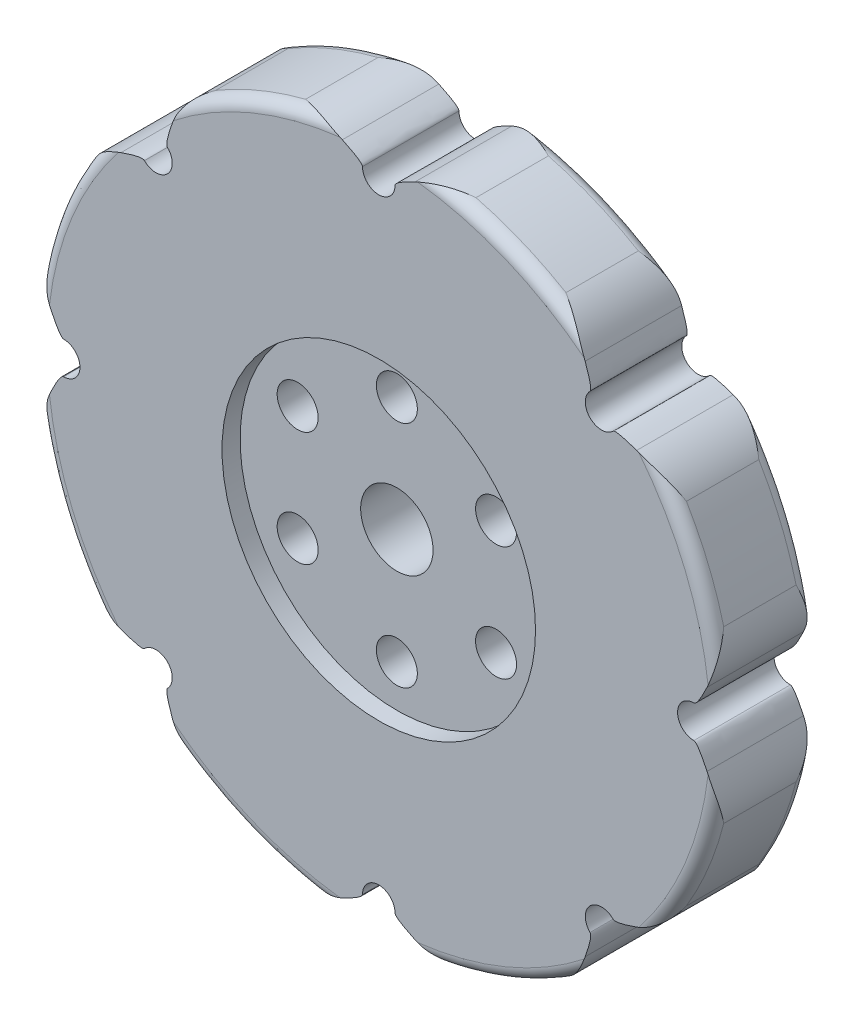
from build123d import *

# Parameters (mm, degrees)
ESQUISSE1_R                        = 28.5
BOSS_EXTRU_1_DEPTH                 = 4
ENL_V_MAT_EXTRU_1_DEPTH            = 41.503086302
CONG_1_R                           = 6
R_P_TITION_CIRCULAIRE1_COUNT       = 8
CONG_1_OF_R_P_TITION_CIRCULAIRE1_R = 6
DIAM_TRE_DU_PER_AGE_6_0_6_1_D      = 6
D_GAGEMENT_M31_D                   = 3.4
ESQUISSE9_R                        = 13
ENL_V_MAT_EXTRU_2_DEPTH            = 1.5


with BuildPart() as part:
    # Esquisse1 → Boss.-Extru.1 (new, symmetric)
    with BuildSketch(Plane.XY):
        Circle(ESQUISSE1_R)
    extrude(amount=BOSS_EXTRU_1_DEPTH, both=True)

    # Esquisse2 → Enlèv. mat.-Extru.1 (cut, symmetric)
    with BuildSketch(Plane.XY):
        with BuildLine():
            ThreePointArc((-1.35, 26.131259298), (0, 24.781259298), (1.35, 26.131259298))
            add(Edge.make_bspline(
                [(1.35, 26.131259298), (1.35, 26.580785033), (4.948973064, 28.067020961)],
                knots=[0, 0, 0, 1, 1, 1], degree=2))
            ThreePointArc((4.948973064, 28.067020961), (0, 28.5), (-4.948973064, 28.067020961))
            add(Edge.make_bspline(
                [(-1.35, 26.131259298), (-1.35, 26.580785033), (-4.948973064, 28.067020961)],
                knots=[0, 0, 0, 1, 1, 1], degree=2))
        make_face()
    enl_v_mat_extru_1 = extrude(amount=ENL_V_MAT_EXTRU_1_DEPTH, both=True, mode=Mode.SUBTRACT)

    # Congé1
    cong_1_edges = [part.edges().sort_by_distance(p)[0] for p in [
        (4.948973064, 28.067020961, -2),
        (-4.948973064, 28.067020961, 2),
    ]]
    fillet(cong_1_edges, radius=CONG_1_R)

    # Répétition circulaire1: Enlèv. mat.-Extru.1 ×8 about axis
    r_p_tition_circulaire1_axis = Axis((0, 0, 5.797806119), (0, 0, -1))
    for i in range(1, R_P_TITION_CIRCULAIRE1_COUNT):
        add(enl_v_mat_extru_1.rotate(r_p_tition_circulaire1_axis, i * 360 / R_P_TITION_CIRCULAIRE1_COUNT), mode=Mode.SUBTRACT)

    # Congé1 of Répétition circulaire1
    cong_1_of_r_p_tition_circulaire1_edges = [part.edges().sort_by_distance(p)[0] for p in [
        (23.345833262, 16.346928436, -2),
        (16.346928436, 23.345833262, 2),
        (28.067020961, -4.948973064, -2),
        (28.067020961, 4.948973064, 2),
        (16.346928436, -23.345833262, -2),
        (23.345833262, -16.346928436, 2),
        (-4.948973064, -28.067020961, -2),
        (4.948973064, -28.067020961, 2),
        (-23.345833262, -16.346928436, -2),
        (-16.346928436, -23.345833262, 2),
        (-28.067020961, 4.948973064, -2),
        (-28.067020961, -4.948973064, 2),
        (-16.346928436, 23.345833262, -2),
        (-23.345833262, 16.346928436, 2),
    ]]
    fillet(cong_1_of_r_p_tition_circulaire1_edges, radius=CONG_1_OF_R_P_TITION_CIRCULAIRE1_R)

    # Diamètre du perçage Ø6.0 (6)1 (through all)
    with Locations(Plane.XY.offset(4)):
        with Locations((0, 0)):
            Hole(DIAM_TRE_DU_PER_AGE_6_0_6_1_D / 2)

    # Dégagement M31 (through all)
    with Locations(Plane.XY.offset(4)):
        with Locations((0, 9.5), (8.227241336, -4.75), (8.227241336, 4.75), (0, -9.5), (-8.227241336, -4.75), (-8.227241336, 4.75)):
            Hole(D_GAGEMENT_M31_D / 2)

    # Esquisse9 → Enlèv. mat.-Extru.2 (cut)
    with BuildSketch(Plane.XY.offset(4)):
        Circle(ESQUISSE9_R)
    enl_v_mat_extru_2 = extrude(amount=-ENL_V_MAT_EXTRU_2_DEPTH, mode=Mode.SUBTRACT)

    # Symétrie1: Enlèv. mat.-Extru.2 across plane
    add(enl_v_mat_extru_2.mirror(Plane.XY), mode=Mode.SUBTRACT)

    # Congé2: read off the stored shape, not the designer's step
    # Congé2 outline → Congé2 (revolve, cut)
    with BuildSketch(Plane.XZ):
        with BuildLine():
            ThreePointArc((28.5, -3), (28.207106781, -3.707106781), (27.5, -4))
            Line((27.5, -4), (28.5, -4))
            Line((28.5, -4), (28.5, -3))
        make_face()
        with BuildLine():
            ThreePointArc((27.5, 4), (28.207106781, 3.707106781), (28.5, 3))
            Line((28.5, 3), (28.5, 4))
            Line((28.5, 4), (27.5, 4))
        make_face()
    revolve(axis=Axis((0, 0, 0), (0, 0, 1)), mode=Mode.SUBTRACT)


solid = part.part
